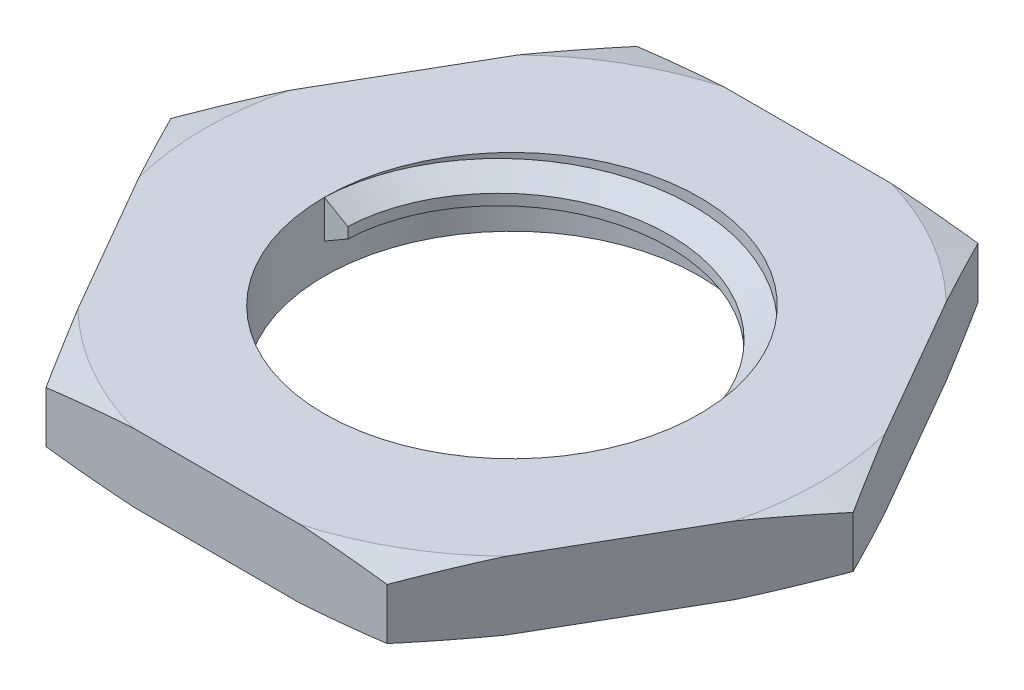
from build123d import *

# Parameters (mm, degrees)
SALIENTE_EXTRUIR1_DEPTH = 2
CROQUIS2_R              = 5.5
CORTAR_EXTRUIR1_DEPTH   = 14.37908816
ROSCA1_PITCH            = 1.27


with BuildPart() as part:
    # Croquis1 → Saliente-Extruir1 (new body)
    with BuildSketch(Plane(origin=(0, 0, 0), x_dir=(1, 0, 0), z_dir=(0, 1, 0))):
        Polygon((5, -8.660254038), (10, 0), (5, 8.660254038), (-5, 8.660254038), (-10, 0), (-5, -8.660254038), align=None)
    extrude(amount=SALIENTE_EXTRUIR1_DEPTH)

    # Croquis2 → Cortar-Extruir1 (cut, through all)
    with BuildSketch(Plane(origin=(0, 2, 0), x_dir=(1, 0, 0), z_dir=(0, 1, 0))):
        with Locations(Location((0, 0, 0), (0, 0, 270))):
            Circle(CROQUIS2_R)
    extrude(amount=-CORTAR_EXTRUIR1_DEPTH, mode=Mode.SUBTRACT)

    # Rosca1: the profile of Perfil de rosca1 profile screwed along a right-hand helix of 0.612205 turns, 8 arcs to a turn; built about Z, then put on its axis
    rosca1_z = Axis((0, 0, 0), (0, 0, 1))
    rosca1_corners = [(5.5003, 0, -0.000173205), (5.5003, 0, 1.111423202), (4.812592339, 0, 0.714374998), (4.812592339, 0, 0.396874998)]
    with BuildLine(mode=Mode.PRIVATE) as rosca1_profile:
        Line(rosca1_corners[0], rosca1_corners[1])
        Line(rosca1_corners[1], rosca1_corners[2])
        Line(rosca1_corners[2], rosca1_corners[3])
        Line(rosca1_corners[3], rosca1_corners[0])
    rosca1_cap = Face(rosca1_profile.wire())
    rosca1_turn_angles = [0, 22.5, 45, 67.5, 90, 112.5, 135, 157.5, 180, 200.196850394, 220.393700787]
    rosca1_turn_weights = [1, 0.9238795325112867, 1, 0.9238795325112867, 1, 0.9238795325112867, 1, 0.9238795325112867, 1, 0.9385120027288921, 1]
    rosca1_turn_rails = [Edge.make_bspline([Vector(p[0], p[1], 0).rotate(rosca1_z, rosca1_turn_angles[k]) / rosca1_turn_weights[k] + Vector(0, 0, p[2] + ROSCA1_PITCH * rosca1_turn_angles[k] / 360) for k in range(11)], [0, 0, 0, 1, 1, 2, 2, 3, 3, 4, 4, 5, 5, 5], 2, rosca1_turn_weights) for p in rosca1_corners]
    rosca1_turn_sides = [Face.make_surface_from_curves(rosca1_turn_rails[p[0]], rosca1_turn_rails[p[1]]) for p in [(0, 1), (1, 2), (2, 3), (3, 0)]]
    rosca1 = Plane(origin=(0, 2, 0), x_dir=(-1, 0, 0), z_dir=(0, -1, 0)) * Solid(Shell([*rosca1_turn_sides, rosca1_cap, rosca1_cap.rotate(rosca1_z, 220.393700787).moved(Location((0, 0, ROSCA1_PITCH * 220.393700787 / 360)))]))
    add(rosca1)

    # Croquis5 → Cortar-Revolución2 (revolve, cut)
    with BuildSketch(Plane.XY):
        Polygon((10, 2), (9, 2), (10, 1.75), align=None)
        Polygon((10, 0), (9, 0), (10, 0.25), align=None)
    revolve(axis=Axis((0, 2, 0), (0, -1, 0)), mode=Mode.SUBTRACT)


solid = part.part
